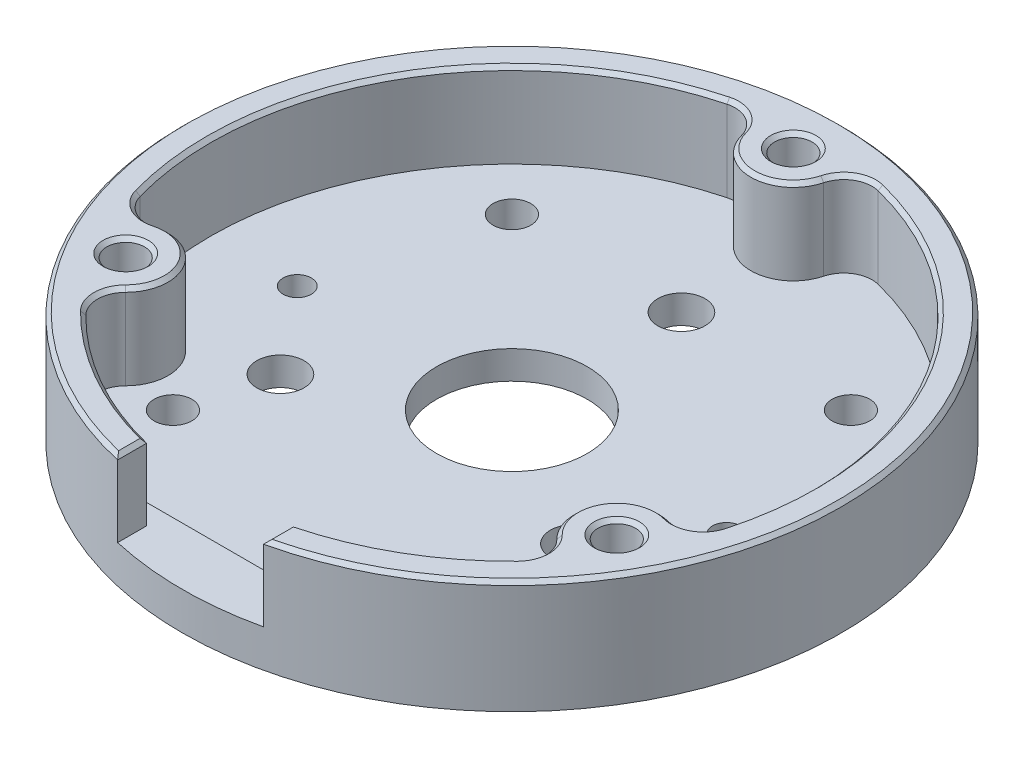
from build123d import *

# Parameters (mm, degrees)
SKETCH_1_R          = 35
SKETCH_1_R_2        = 8
EXTRUDE_1_DEPTH     = 3
SKETCH_2_R          = 35
SKETCH_2_R_2        = 2
EXTRUDE_2_DEPTH     = 9
SKETCH_3_R          = 1.5
CUT_EXTRUDE_1_DEPTH = 8
SKETCH_4_R          = 2.50640253
CUT_EXTRUDE_2_DEPTH = 8
SKETCH_7_R          = 2
CUT_EXTRUDE_4_DEPTH = 12
EXTRUDE_4_DEPTH     = 1
SKETCH_9_W          = 15.497656666
SKETCH_9_H          = 9.48184561
CUT_EXTRUDE_5_DEPTH = 11
CHAMFER_1_SIZE      = 0.4


with BuildPart() as part:
    # Эскиз1 → Бобышка-Вытянуть1 (new body)
    with BuildSketch(Plane(origin=(0, 0, 0), x_dir=(1, 0, 0), z_dir=(0, 1, 0))):
        Circle(SKETCH_1_R)
        Circle(SKETCH_1_R_2, mode=Mode.SUBTRACT)
    extrude(amount=EXTRUDE_1_DEPTH)

    # Эскиз2 → Бобышка-Вытянуть2 (add)
    with BuildSketch(Plane(origin=(0, 3, 0), x_dir=(1, 0, 0), z_dir=(0, 1, 0))):
        Circle(SKETCH_2_R)
        with Locations((-0.113661048, 30)):
            Circle(SKETCH_2_R_2, mode=Mode.SUBTRACT)
        with Locations((26.037592637, -14.901566645)):
            Circle(SKETCH_2_R_2, mode=Mode.SUBTRACT)
        with Locations((-25.92393159, -15.098433355)):
            Circle(SKETCH_2_R_2, mode=Mode.SUBTRACT)
        with BuildLine():
            ThreePointArc((-8.117111797, 30.953392319), (-27.773232815, 15.894890343), (-30.80008796, -8.680701679))
            ThreePointArc((-30.80008796, -8.680701679), (-29.387206086, -10.479447295), (-27.117120464, -10.75950488))
            ThreePointArc((-27.117120464, -10.75950488), (-22.03536976, -12.833684606), (-22.738725961, -18.277185484))
            ThreePointArc((-22.738725961, -18.277185484), (-23.615248532, -20.389868414), (-22.747868184, -22.506321181))
            ThreePointArc((-22.747868184, -22.506321181), (0.121237581, -31.999770334), (22.917752157, -22.333307773))
            ThreePointArc((22.917752157, -22.333307773), (23.769070618, -20.210343369), (22.87656479, -18.10436276))
            ThreePointArc((22.87656479, -18.10436276), (22.131981773, -12.666347691), (27.197869919, -10.55372159))
            ThreePointArc((27.197869919, -10.55372159), (29.465768293, -10.256470938), (30.86497998, -8.447071138))
            ThreePointArc((30.86497998, -8.447071138), (27.651995235, 16.104879992), (7.882335804, 31.014009452))
            ThreePointArc((7.882335804, 31.014009452), (5.618135468, 30.689790665), (4.240555674, 28.863867639))
            ThreePointArc((4.240555674, 28.863867639), (-0.096612013, 25.500032297), (-4.459143958, 28.830907074))
            ThreePointArc((-4.459143958, 28.830907074), (-5.850519761, 30.646339352), (-8.117111797, 30.953392319))
        make_face(mode=Mode.SUBTRACT)
    extrude(amount=EXTRUDE_2_DEPTH)

    # Эскиз3 → Вырез-Вытянуть1 (cut)
    with BuildSketch(Plane(origin=(0, 3, 0), x_dir=(1, 0, 0), z_dir=(0, 1, 0))):
        with Locations((22.8, 0)):
            Circle(SKETCH_3_R)
        with Locations((-22.8, 0)):
            Circle(SKETCH_3_R)
    extrude(amount=-CUT_EXTRUDE_1_DEPTH, mode=Mode.SUBTRACT)

    # Эскиз4 → Вырез-Вытянуть2 (cut)
    with BuildSketch(Plane(origin=(0, 3, 0), x_dir=(1, 0, 0), z_dir=(0, 1, 0))):
        with Locations((0, 18)):
            Circle(SKETCH_4_R)
        with Locations((15.588457268, -9)):
            Circle(SKETCH_4_R)
        with Locations((-15.588457268, -9)):
            Circle(SKETCH_4_R)
    extrude(amount=-CUT_EXTRUDE_2_DEPTH, mode=Mode.SUBTRACT)

    # Эскиз7 → Вырез-Вытянуть4 (cut)
    with BuildSketch(Plane(origin=(0, 3, 0), x_dir=(1, 0, 0), z_dir=(0, 1, 0))):
        with Locations((-18, -18)):
            Circle(SKETCH_7_R)
        with Locations((18, -18)):
            Circle(SKETCH_7_R)
        with Locations((-18, 18)):
            Circle(SKETCH_7_R)
        with Locations((18, 18)):
            Circle(SKETCH_7_R)
    extrude(amount=-CUT_EXTRUDE_4_DEPTH, mode=Mode.SUBTRACT)

    # Эскиз8 → Бобышка-Вытянуть4 (add)
    with BuildSketch(Plane(origin=(0, 3, 0), x_dir=(1, 0, 0), z_dir=(0, 1, 0))):
        with BuildLine():
            Line((-13.748828333, -28.895842598), (13.748828333, -28.895842598))
            ThreePointArc((13.748828333, -28.895842598), (0, -32), (-13.748828333, -28.895842598))
        make_face()
    extrude(amount=EXTRUDE_4_DEPTH)

    # Эскиз9 → Вырез-Вытянуть5 (cut)
    with BuildSketch(Plane(origin=(0, 0, 28.895842598), x_dir=(-1, 0, 0), z_dir=(0, 0, -1))):
        with Locations((0, 8.740922805)):
            Rectangle(SKETCH_9_W, SKETCH_9_H)
    extrude(amount=-CUT_EXTRUDE_5_DEPTH, mode=Mode.SUBTRACT)

    # Фаска1
    chamfer_1_edges = [part.edges().sort_by_distance(p)[0] for p in [
        (-27.92393159, 12, 15.098433355),
        (-2.113661048, 12, -30),
        (24.037592637, 12, 14.901566645),
        (15.940347108, 12, 27.747168037),
        (23.769070618, 12, 20.210343369),
        (22.131981773, 12, 12.666347691),
        (29.465768293, 12, 10.256470938),
        (27.651995235, 12, -16.104879992),
        (5.618135468, 12, -30.689790665),
        (-0.096612013, 12, -25.500032297),
        (-5.850519761, 12, -30.646339352),
        (-27.773232815, 12, -15.894890343),
        (-29.387206086, 12, 10.479447295),
        (-22.03536976, 12, 12.833684606),
        (-23.615248532, 12, 20.389868414),
        (-15.835107718, 12, 27.807361679),
        (-7.748828333, 12, 32.589541055),
        (-21.837937269, 12, -27.351498969),
        (7.748828333, 12, 32.589541055),
    ]]
    chamfer(chamfer_1_edges, length=CHAMFER_1_SIZE)


solid = part.part
